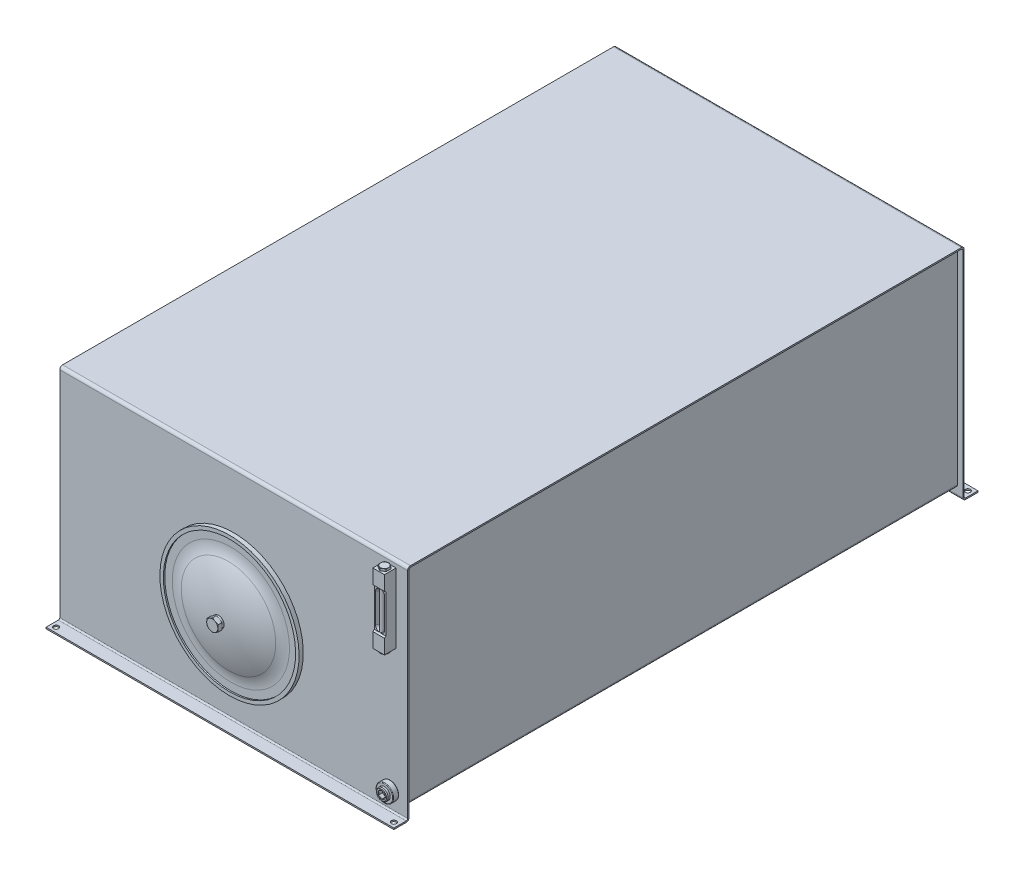
from build123d import *

# Parameters (mm, degrees)
EXTRUDE_THIN1_DEPTH              = 381
EXTRUDE_THIN2_REACH              = 889.333
EXTRUDE_THIN2_DIRECTION_2_REACH  = 889.333
SKETCH5_R                        = 5.588
CUT_EXTRUDE2_DEPTH               = 888.332979442
BOSS_EXTRUDE1_DEPTH              = 9.6012
SKETCH8_OUTSIDE_W                = 1123.714
SKETCH8_OUTSIDE_H                = 996.714
SKETCH8_OUTSIDE_R                = 12.192
CUT_EXTRUDE3_DEPTH               = 9.6012
CUT_EXTRUDE3_DRAFT               = -60
SKETCH9_OUTSIDE_W                = 6033.99
SKETCH9_OUTSIDE_H                = 5906.99
SKETCH9_OUTSIDE_R                = 12.192
CUT_EXTRUDE4_DEPTH               = 1427.075936154
CUT_EXTRUDE4_DRAFT               = -60
SKETCH10_W                       = 25.4
SKETCH10_H                       = 152.4
BOSS_EXTRUDE2_DEPTH              = 25.4
BOSS_EXTRUDE12_DEPTH             = 5.08
SKETCH32_OUTSIDE_W               = 1108.448
SKETCH32_OUTSIDE_H               = 1642.761
SKETCH32_OUTSIDE_R               = 8.89
CUT_EXTRUDE13_DEPTH              = 5.08
CUT_EXTRUDE13_DRAFT              = -60
SKETCH33_OUTSIDE_W               = 1108.448
SKETCH33_OUTSIDE_H               = 1642.761
SKETCH33_OUTSIDE_R               = 8.89
CUT_EXTRUDE14_DEPTH              = 5.08
CUT_EXTRUDE14_DRAFT              = -60
CUT_EXTRUDE12_DEPTH              = 908.68432131
CUT_EXTRUDE15_DEPTH              = 7.62
CUT_EXTRUDE15_DRAFT              = -35
BOSS_EXTRUDE13_REACH             = 944.591
SKETCH35_R                       = 5.034961234
BOSS_EXTRUDE13_DIRECTION_2_REACH = 944.591
SKETCH15_R                       = 19.05
BOSS_EXTRUDE5_DEPTH              = 12.7
SKETCH16_R                       = 12.7
BOSS_EXTRUDE6_DEPTH              = 6.35
CUT_EXTRUDE7_DEPTH               = 8.89
CHAMFER2_SIZE                    = 1.778
FILLET2_R                        = 1.27


with BuildPart() as part:
    # Sketch1 → Extrude-Thin1 (new, symmetric)
    with BuildSketch(Plane(origin=(0, 0, 0), x_dir=(0, 0, -1), z_dir=(1, 0, 0))):
        with BuildLine():
            Line((-639.7625, 3.048), (-612.775, 3.048))
            ThreePointArc((-612.775, 3.048), (-610.52993597, 3.97793597), (-609.6, 6.223))
            Line((-609.6, 6.223), (-609.6, 476.377))
            ThreePointArc((-609.6, 476.377), (-607.777325499, 480.777325499), (-603.377, 482.6))
            Line((-603.377, 482.6), (603.377, 482.6))
            ThreePointArc((603.377, 482.6), (607.777325499, 480.777325499), (609.6, 476.377))
            Line((609.6, 476.377), (609.6, 6.223))
            ThreePointArc((609.6, 6.223), (610.52993597, 3.97793597), (612.775, 3.048))
            Line((612.775, 3.048), (639.7625, 3.048))
            Line((639.7625, 3.048), (639.7625, 0))
            Line((639.7625, 0), (612.775, 0))
            ThreePointArc((612.775, 0), (608.374674501, 1.822674501), (606.552, 6.223))
            Line((606.552, 6.223), (606.552, 476.377))
            ThreePointArc((606.552, 476.377), (605.62206403, 478.62206403), (603.377, 479.552))
            Line((603.377, 479.552), (-603.377, 479.552))
            ThreePointArc((-603.377, 479.552), (-605.62206403, 478.62206403), (-606.552, 476.377))
            Line((-606.552, 476.377), (-606.552, 6.223))
            ThreePointArc((-606.552, 6.223), (-608.374674501, 1.822674501), (-612.775, 0))
            Line((-612.775, 0), (-639.7625, 0))
            Line((-639.7625, 0), (-639.7625, 3.048))
        make_face()
    extrude(amount=EXTRUDE_THIN1_DEPTH, both=True)


with BuildPart() as body_2:

    # Sketch4 → Extrude-Thin2 (new, up to next)
    with BuildSketch(Plane.XY, mode=Mode.PRIVATE) as extrude_thin2_sk1:
        with BuildLine():
            Line((368.935, 479.552), (368.935, 25.273))
            ThreePointArc((368.935, 25.273), (367.112325499, 20.872674501), (362.712, 19.05))
            Line((362.712, 19.05), (-362.712, 19.05))
            ThreePointArc((-362.712, 19.05), (-367.112325499, 20.872674501), (-368.935, 25.273))
            Line((-368.935, 25.273), (-368.935, 479.552))
            Line((-368.935, 479.552), (-365.887, 479.552))
            Line((-365.887, 479.552), (-365.887, 25.273))
            ThreePointArc((-365.887, 25.273), (-364.95706403, 23.02793597), (-362.712, 22.098))
            Line((-362.712, 22.098), (362.712, 22.098))
            ThreePointArc((362.712, 22.098), (364.95706403, 23.02793597), (365.887, 25.273))
            Line((365.887, 25.273), (365.887, 479.552))
            Line((365.887, 479.552), (368.935, 479.552))
        make_face()
    extrude_thin2_tool1 = extrude(extrude_thin2_sk1.sketch, amount=EXTRUDE_THIN2_REACH, mode=Mode.PRIVATE) - part.part
    add(extrude_thin2_tool1.solids().sort_by_distance((365.57209, 22.41291, 0))[0])


    # Sketch4 → Extrude-Thin2 direction 2 (add, up to next)
    with BuildSketch(Plane.XY, mode=Mode.PRIVATE) as extrude_thin2_direction_2_sk1:
        with BuildLine():
            Line((368.935, 479.552), (368.935, 25.273))
            ThreePointArc((368.935, 25.273), (367.112325499, 20.872674501), (362.712, 19.05))
            Line((362.712, 19.05), (-362.712, 19.05))
            ThreePointArc((-362.712, 19.05), (-367.112325499, 20.872674501), (-368.935, 25.273))
            Line((-368.935, 25.273), (-368.935, 479.552))
            Line((-368.935, 479.552), (-365.887, 479.552))
            Line((-365.887, 479.552), (-365.887, 25.273))
            ThreePointArc((-365.887, 25.273), (-364.95706403, 23.02793597), (-362.712, 22.098))
            Line((-362.712, 22.098), (362.712, 22.098))
            ThreePointArc((362.712, 22.098), (364.95706403, 23.02793597), (365.887, 25.273))
            Line((365.887, 25.273), (365.887, 479.552))
            Line((365.887, 479.552), (368.935, 479.552))
        make_face()
    extrude_thin2_direction_2_tool1 = extrude(extrude_thin2_direction_2_sk1.sketch, amount=-EXTRUDE_THIN2_DIRECTION_2_REACH, mode=Mode.PRIVATE) - part.part
    add(extrude_thin2_direction_2_tool1.solids().sort_by_distance((365.57209, 22.41291, 0))[0])


with BuildPart() as part_1:
    add(part.part)

    # Sketch5 → Cut-Extrude2 (cut, through all)
    with BuildSketch(Plane(origin=(0, 0, 0), x_dir=(1, 0, 0), z_dir=(0, 1, 0))):
        with Locations(Location((-369.8875, -628.65, 0), (0, 0, 90))):
            Circle(SKETCH5_R)
        with Locations(Location((369.8875, -628.65, 0), (0, 0, 90))):
            Circle(SKETCH5_R)
    cut_extrude2 = extrude(amount=CUT_EXTRUDE2_DEPTH, mode=Mode.SUBTRACT)

    # Mirror1: Cut-Extrude2 across plane
    add(cut_extrude2.mirror(Plane.XY), mode=Mode.SUBTRACT)


with BuildPart() as body_3:
    # Sketch6 → Revolve1 (revolve)
    with BuildSketch(Plane(origin=(0, 0, 0), x_dir=(0, 0, -1), z_dir=(1, 0, 0)), mode=Mode.PRIVATE) as revolve1_sk:
        with BuildLine():
            Line((-618.86592, 152.4), (-618.86592, 144.84096))
            Line((-618.86592, 144.84096), (-615.77728, 144.84096))
            Line((-615.77728, 144.84096), (-615.77728, 128.355545231))
            ThreePointArc((-615.77728, 128.355545231), (-617.115824701, 115.651070898), (-621.072675934, 103.504520017))
            ThreePointArc((-621.072675934, 103.504520017), (-636.21052132, 58.862738862), (-642.835105971, 12.192))
            Line((-642.835105971, 12.192), (-656.551105971, 12.192))
            Line((-656.551105971, 12.192), (-656.551105971, 0))
            Line((-656.551105971, 0), (-609.6, 0))
            Line((-609.6, 0), (-609.6, 152.4))
            Line((-609.6, 152.4), (-618.86592, 152.4))
        make_face()
    revolve(revolve1_sk.sketch.rotate(Axis((0, 0, 656.551105971), (0, 0, -1)), 180), axis=Axis((0, 0, 656.551105971), (0, 0, -1)))

    # Sketch7 → Boss-Extrude1 (add)
    with BuildSketch(Plane.XY.offset(656.551105971)):
        Polygon((12.192, 7.039054482), (0, 14.078108964), (-12.192, 7.039054482), (-12.192, -7.039054482), (0, -14.078108964), (12.192, -7.039054482), align=None)
    extrude(amount=-BOSS_EXTRUDE1_DEPTH)


with BuildPart() as cut_extrude3_tool:
    # Sketch8 outside → Cut-Extrude3 (with draft: the straight prism first)
    with BuildSketch(Plane.XY.offset(656.551105971)):
        with Locations((0, 165.1)):
            Rectangle(SKETCH8_OUTSIDE_W, SKETCH8_OUTSIDE_H)
        with Locations(Location((0, 0, 0), (0, 0, 270))):
            Circle(SKETCH8_OUTSIDE_R, mode=Mode.SUBTRACT)
    extrude(amount=-CUT_EXTRUDE3_DEPTH)
    # Cut-Extrude3: the draft: its side faces are tilted about the plane it starts from
    cut_extrude3_sides = [cut_extrude3_tool.faces().sort_by_distance(p)[0] for p in [
        (0, -333.257, 651.750505971),
        (561.857, 165.1, 651.750505971),
        (0, 663.457, 651.750505971),
        (-561.857, 165.1, 651.750505971),
        (0, 12.192, 651.750505971),
    ]]
    draft(cut_extrude3_sides, Plane.XY.offset(656.551105971), CUT_EXTRUDE3_DRAFT)


with BuildPart() as body_3_1:
    add(body_3.part)

    # Cut-Extrude3: cut by cut_extrude3_tool
    add(cut_extrude3_tool.part, mode=Mode.SUBTRACT)


with BuildPart() as cut_extrude4_tool:
    # Sketch9 outside → Cut-Extrude4 (with draft: the straight prism first)
    with BuildSketch(Plane(origin=(0, 0, 646.949905971), x_dir=(-1, 0, 0), z_dir=(0, 0, -1))):
        with Locations((0, 165.1)):
            Rectangle(SKETCH9_OUTSIDE_W, SKETCH9_OUTSIDE_H)
        with Locations(Location((0, 0, 0), (0, 0, 270))):
            Circle(SKETCH9_OUTSIDE_R, mode=Mode.SUBTRACT)
    extrude(amount=-CUT_EXTRUDE4_DEPTH)
    # Cut-Extrude4: the draft: its side faces are tilted about the plane it starts from
    cut_extrude4_sides = [cut_extrude4_tool.faces().sort_by_distance(p)[0] for p in [
        (0, -2788.395, 1360.487874048),
        (-3016.995, 165.1, 1360.487874048),
        (0, 3118.595, 1360.487874048),
        (3016.995, 165.1, 1360.487874048),
        (0, 12.192, 1360.487874048),
    ]]
    draft(cut_extrude4_sides, Plane(origin=(0, 0, 646.949905971), x_dir=(-1, 0, 0), z_dir=(0, 0, -1)), CUT_EXTRUDE4_DRAFT)


with BuildPart() as body_3_2:
    add(body_3_1.part)

    # Cut-Extrude4: cut by cut_extrude4_tool
    add(cut_extrude4_tool.part, mode=Mode.SUBTRACT)


with BuildPart() as body_4:
    # Sketch10 → Boss-Extrude2 (new body)
    with BuildSketch(Plane.XY.offset(609.6)):
        with Locations((0, 406.4)):
            Rectangle(SKETCH10_W, SKETCH10_H)
    extrude(amount=BOSS_EXTRUDE2_DEPTH)

    # Sketch31 → Boss-Extrude12 (add)
    with BuildSketch(Plane(origin=(0, 482.6, 0), x_dir=(1, 0, 0), z_dir=(0, 1, 0))):
        Polygon((8.89, -627.432643893), (8.89, -617.167356107), (0, -612.034712214), (-8.89, -617.167356107), (-8.89, -627.432643893), (0, -632.565287786), align=None)
    boss_extrude12 = extrude(amount=BOSS_EXTRUDE12_DEPTH)

    # Mirror13: Boss-Extrude12 across plane
    add(boss_extrude12.mirror(Plane.ZX.offset(406.4)))


with BuildPart() as cut_extrude13_tool:
    # Sketch32 outside → Cut-Extrude13 (with draft: the straight prism first)
    with BuildSketch(Plane(origin=(0, 487.68, 0), x_dir=(1, 0, 0), z_dir=(0, 1, 0))):
        with Locations((0, -8.3945)):
            Rectangle(SKETCH32_OUTSIDE_W, SKETCH32_OUTSIDE_H)
        with Locations((0, -622.3)):
            Circle(SKETCH32_OUTSIDE_R, mode=Mode.SUBTRACT)
    extrude(amount=-CUT_EXTRUDE13_DEPTH)
    # Cut-Extrude13: the draft: its side faces are tilted about the plane it starts from
    cut_extrude13_sides = [cut_extrude13_tool.faces().sort_by_distance(p)[0] for p in [
        (0, 485.14, 829.775),
        (554.224, 485.14, 8.3945),
        (0, 485.14, -812.986),
        (-554.224, 485.14, 8.3945),
        (-8.89, 485.14, 622.3),
    ]]
    draft(cut_extrude13_sides, Plane(origin=(0, 487.68, 0), x_dir=(1, 0, 0), z_dir=(0, 1, 0)), CUT_EXTRUDE13_DRAFT)


with BuildPart() as body_4_1:
    add(body_4.part)

    # Cut-Extrude13: cut by cut_extrude13_tool
    add(cut_extrude13_tool.part, mode=Mode.SUBTRACT)


with BuildPart() as cut_extrude14_tool:
    # Sketch33 outside → Cut-Extrude14 (with draft: the straight prism first)
    with BuildSketch(Plane.XZ.offset(-325.12)):
        with Locations((0, 8.3945)):
            Rectangle(SKETCH33_OUTSIDE_W, SKETCH33_OUTSIDE_H)
        with Locations((0, 622.3)):
            Circle(SKETCH33_OUTSIDE_R, mode=Mode.SUBTRACT)
    extrude(amount=-CUT_EXTRUDE14_DEPTH)
    # Cut-Extrude14: the draft: its side faces are tilted about the plane it starts from
    cut_extrude14_sides = [cut_extrude14_tool.faces().sort_by_distance(p)[0] for p in [
        (0, 327.66, -812.986),
        (554.224, 327.66, 8.3945),
        (0, 327.66, 829.775),
        (-554.224, 327.66, 8.3945),
        (-8.89, 327.66, 622.3),
    ]]
    draft(cut_extrude14_sides, Plane.XZ.offset(-325.12), CUT_EXTRUDE14_DRAFT)


with BuildPart() as body_4_2:
    add(body_4_1.part)

    # Cut-Extrude14: cut by cut_extrude14_tool
    add(cut_extrude14_tool.part, mode=Mode.SUBTRACT)

    # Sketch30 → Cut-Extrude12 (cut, through all)
    with BuildSketch(Plane(origin=(12.7, 0, 0), x_dir=(0, 0, -1), z_dir=(1, 0, 0))):
        Polygon((-635, 450.85), (-635, 361.95), (-631.825, 364.481683603), (-631.825, 448.318316397), align=None)
    extrude(amount=-CUT_EXTRUDE12_DEPTH, mode=Mode.SUBTRACT)


with BuildPart() as cut_extrude15_tool:
    # Sketch34 → Cut-Extrude15 (with draft: the straight prism first)
    with BuildSketch(Plane.XY.offset(631.825)):
        with BuildLine():
            ThreePointArc((-10.16, 374.641683603), (0, 364.481683603), (10.16, 374.641683603))
            Line((10.16, 374.641683603), (10.16, 438.158316397))
            ThreePointArc((10.16, 438.158316397), (0, 448.318316397), (-10.16, 438.158316397))
            Line((-10.16, 438.158316397), (-10.16, 374.641683603))
        make_face()
    extrude(amount=-CUT_EXTRUDE15_DEPTH)
    # Cut-Extrude15: the draft: its side faces are tilted about the plane it starts from
    cut_extrude15_sides = [cut_extrude15_tool.faces().sort_by_distance(p)[0] for p in [
        (0, 364.481683603, 628.015),
        (10.16, 406.4, 628.015),
        (0, 448.318316397, 628.015),
        (-10.16, 406.4, 628.015),
    ]]
    draft(cut_extrude15_sides, Plane.XY.offset(631.825), CUT_EXTRUDE15_DRAFT)


with BuildPart() as body_4_3:
    add(body_4_2.part)

    # Cut-Extrude15: cut by cut_extrude15_tool
    add(cut_extrude15_tool.part, mode=Mode.SUBTRACT)

    # Sketch35 → Boss-Extrude13 (add, up to next)
    with BuildSketch(Plane(origin=(0, 406.4, 0), x_dir=(-1, 0, 0), z_dir=(0, 1, 0)), mode=Mode.PRIVATE) as boss_extrude13_sk1:
        with Locations((0, 626.536038766)):
            Circle(SKETCH35_R)
    boss_extrude13_tool1 = extrude(boss_extrude13_sk1.sketch, amount=BOSS_EXTRUDE13_REACH, mode=Mode.PRIVATE) - body_4_3.part
    add(boss_extrude13_tool1.solids().sort_by_distance((0, 406.4, 626.536039))[0])

    # Sketch35 → Boss-Extrude13 direction 2 (add, up to next)
    with BuildSketch(Plane(origin=(0, 406.4, 0), x_dir=(-1, 0, 0), z_dir=(0, 1, 0)), mode=Mode.PRIVATE) as boss_extrude13_direction_2_sk1:
        with Locations((0, 626.536038766)):
            Circle(SKETCH35_R)
    boss_extrude13_direction_2_tool1 = extrude(boss_extrude13_direction_2_sk1.sketch, amount=-BOSS_EXTRUDE13_DIRECTION_2_REACH, mode=Mode.PRIVATE) - body_4_3.part
    add(boss_extrude13_direction_2_tool1.solids().sort_by_distance((0, 406.4, 626.536039))[0])


with BuildPart() as body_5:
    # Sketch15 → Boss-Extrude5 (new body)
    with BuildSketch(Plane.XY.offset(609.6)):
        with Locations((0, 41.2496)):
            Circle(SKETCH15_R)
    extrude(amount=BOSS_EXTRUDE5_DEPTH)

    # Sketch16 → Boss-Extrude6 (add)
    with BuildSketch(Plane.XY.offset(622.3)):
        with Locations((0, 41.2496)):
            Circle(SKETCH16_R)
    extrude(amount=BOSS_EXTRUDE6_DEPTH)

    # Sketch17 → Cut-Extrude7 (cut)
    with BuildSketch(Plane.XY.offset(628.65)):
        Polygon((0, 33.008040377), (7.1374, 37.128820189), (7.1374, 45.370379811), (0, 49.491159623), (-7.1374, 45.370379811), (-7.1374, 37.128820189), align=None)
    extrude(amount=-CUT_EXTRUDE7_DEPTH, mode=Mode.SUBTRACT)

    # Cut-Extrude8 cone 1 section (through the dimple's axis) → Cut-Extrude8 (revolve, cut)
    with BuildSketch(Plane(origin=(0, 41.2496, 628.65), x_dir=(0, -1, 0), z_dir=(1, 0, 0))):
        Polygon((0, 0), (8.241559623, 0), (0, 8.241559623), align=None)
    revolve(axis=Axis((0, 41.2496, 628.65), (0, 0, -1)), mode=Mode.SUBTRACT)

    # Chamfer2
    chamfer2_edges = [body_5.edges().sort_by_distance(p)[0] for p in [
        (-12.7, 41.2496, 628.65),
    ]]
    chamfer(chamfer2_edges, length=CHAMFER2_SIZE)

    # Fillet2
    fillet2_edges = [body_5.edges().sort_by_distance(p)[0] for p in [
        (-19.05, 41.2496, 609.6),
        (-19.05, 41.2496, 622.3),
    ]]
    fillet(fillet2_edges, radius=FILLET2_R)


with BuildPart() as body_3_3:
    # Body-Move/Copy14: moved
    add(body_3_2.part.moved(Location((0, 205.41996, 0))))


with BuildPart() as body_4_4:
    # Body-Move/Copy13: moved
    add(body_4_3.part.moved(Location((342.9, 0, 0))))


with BuildPart() as body_5_1:
    # Body-Move/Copy13: moved
    add(body_5.part.moved(Location((342.9, 0, 0))))


with BuildPart() as body_4_5:
    # Body-Move/Copy15: moved
    add(body_4_4.part.moved(Location((0, -13.97, 0))))


with BuildPart() as body_6:
    # Mirror9: mirrored copy
    add(body_3_3.part.mirror(Plane.XY))


solid = Compound([body_2.part, part_1.part, body_3_3.part, body_5_1.part, body_4_5.part, body_6.part])
